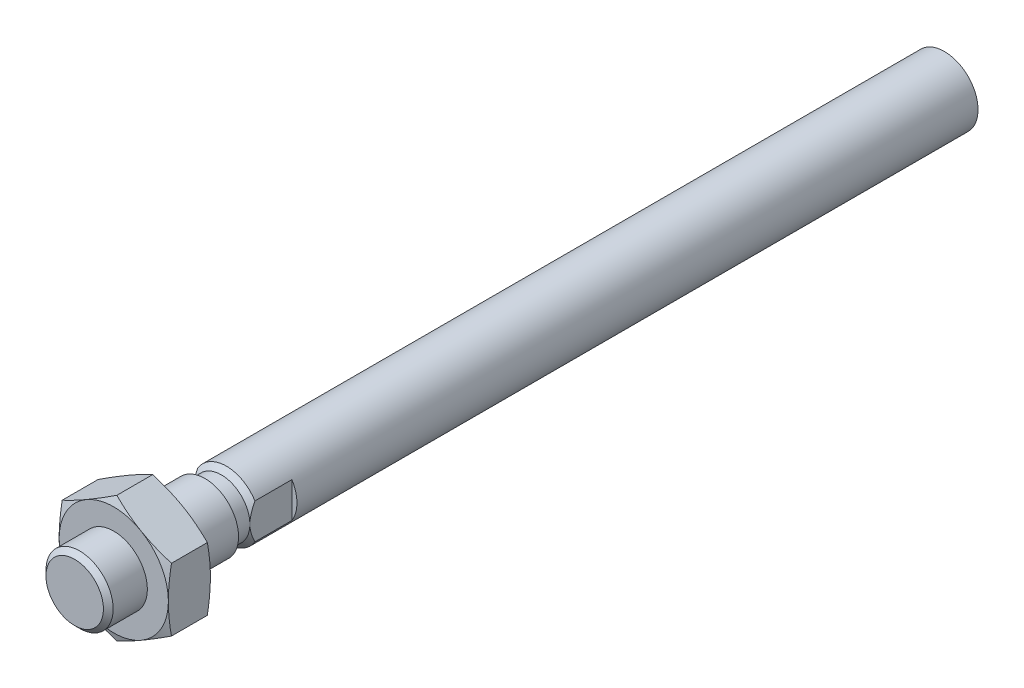
from build123d import *

# Parameters (mm, degrees)
EXTRUDE_START        = 79.5
SKETCH_4_R           = 4
EXTRUDE_1_DEPTH      = 15.5
SKETCH_5_R           = 3.4
EXTRUDE_2_DEPTH      = 1.95
SKETCH_6_R           = 4
EXTRUDE_3_DEPTH      = 86.05
EXTRUDE_START_2      = 74.85
EXTRUDE_4_DEPTH      = 5
CHAMFER_1_SIZE       = 0.58
CHAMFER_2_SIZE       = 0.6
CUT_EXTRUDE_START    = 57.05
SKETCH_9_OUTSIDE_W   = 36.078
SKETCH_9_OUTSIDE_H   = 38.09
SKETCH_9_OUTSIDE_W_2 = 6.8
SKETCH_9_OUTSIDE_H_2 = 15.011106998
CUT_EXTRUDE_1_DEPTH  = 5


with BuildPart() as part:
    # 草图4 → 凸台-拉伸1 (new body)
    with BuildSketch(Plane.XY.offset(EXTRUDE_START)):
        Circle(SKETCH_4_R)
    extrude(amount=-EXTRUDE_1_DEPTH)

    # 草图5 → 凸台-拉伸2 (add)
    with BuildSketch(Plane(origin=(0, 0, 64), x_dir=(-1, 0, 0), z_dir=(0, 0, -1))):
        with Locations(Location((0, 0, 0), (0, 0, 180))):
            Circle(SKETCH_5_R)
    extrude(amount=EXTRUDE_2_DEPTH)

    # 草图6 → 凸台-拉伸3 (add)
    with BuildSketch(Plane(origin=(0, 0, 62.05), x_dir=(-1, 0, 0), z_dir=(0, 0, -1))):
        with Locations(Location((0, 0, 0), (0, 0, 180))):
            Circle(SKETCH_6_R)
    extrude(amount=EXTRUDE_3_DEPTH)

    # 草图7 → 凸台-拉伸4 (add)
    with BuildSketch(Plane.XY.offset(EXTRUDE_START_2)):
        Polygon((6.5, -3.75277675), (6.5, 3.75277675), (0, 7.505553499), (-6.5, 3.75277675), (-6.5, -3.75277675), (0, -7.505553499), align=None)
    extrude(amount=-EXTRUDE_4_DEPTH)

    # 草图8 → 切除-旋转1 (revolve, cut)
    with BuildSketch(Plane(origin=(0, 0, 0), x_dir=(1, 0, 0), z_dir=(0, 1, 0))):
        Polygon((-6.5, -74.85), (-15.368693549, -74.85), (-15.368693549, -69.85), (-6.5, -69.85), (-13.368693549, -72.35), align=None)
    revolve(axis=Axis((0, 0, 52.5), (0, 0, 1)), mode=Mode.SUBTRACT)

    # 倒角1
    chamfer_1_edges = [part.edges().sort_by_distance(p)[0] for p in [
        (-4, 0, 79.5),
    ]]
    chamfer(chamfer_1_edges, length=CHAMFER_1_SIZE)

    # 倒角2
    chamfer_2_edges = [part.edges().sort_by_distance(p)[0] for p in [
        (-4, 0, 62.05),
    ]]
    chamfer(chamfer_2_edges, length=CHAMFER_2_SIZE - 0.0001)  # a hair under: the kernel refuses the full size

    # 草图9 outside → 切除-拉伸1 (cut)
    with BuildSketch(Plane.XY.offset(CUT_EXTRUDE_START)):
        Rectangle(SKETCH_9_OUTSIDE_W, SKETCH_9_OUTSIDE_H)
        Rectangle(SKETCH_9_OUTSIDE_W_2, SKETCH_9_OUTSIDE_H_2, mode=Mode.SUBTRACT)
    extrude(amount=CUT_EXTRUDE_1_DEPTH, mode=Mode.SUBTRACT)


solid = part.part
